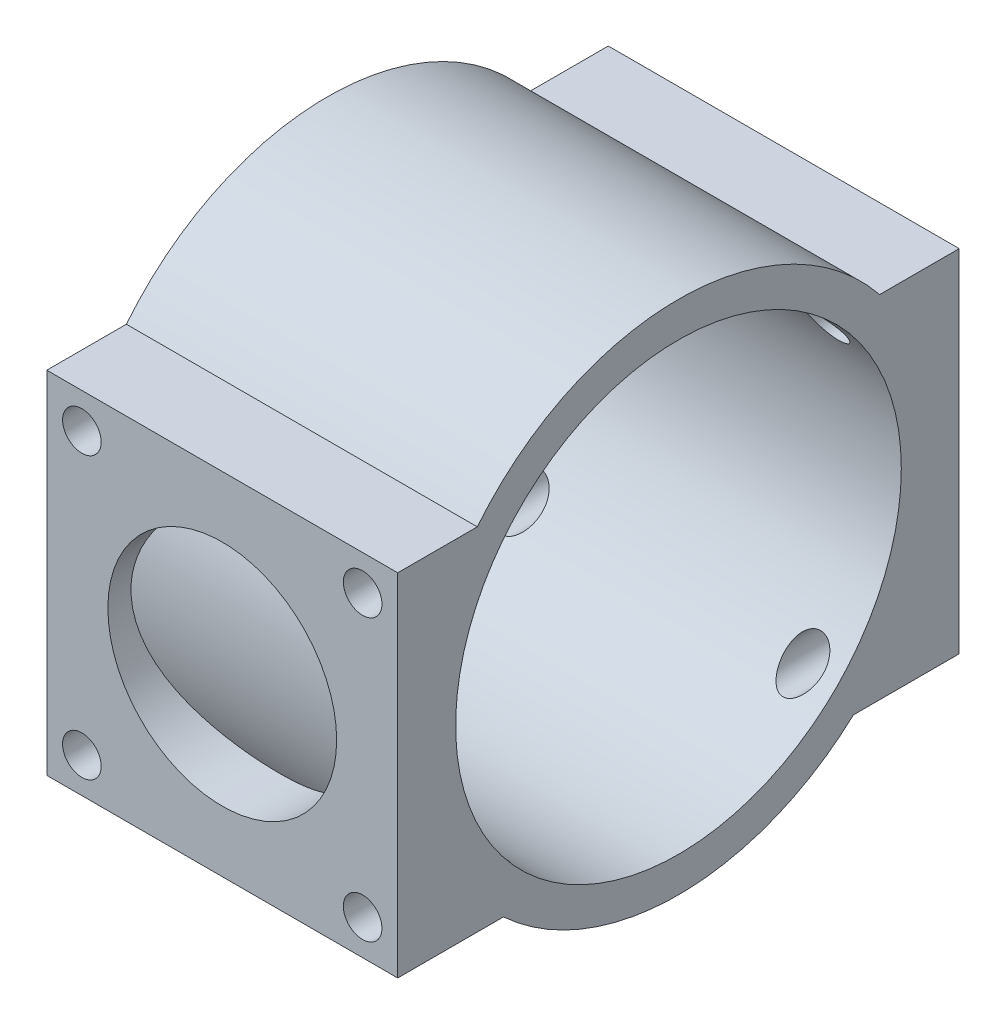
from build123d import *
from build123d.topology import SkipClean

# Parameters (mm, degrees)
SKETCH1_W               = 50
SKETCH1_H               = 50
SKETCH1_R               = 16.3
SKETCH1_R_2             = 2.75
BOSS_EXTRUDE1_DEPTH     = 40
CUT_EXTRUDE1_DEPTH      = 55.350712967
CUT_EXTRUDE1_DEPTH_BACK = 55.350712967
SKETCH2_R               = 31.75
BOSS_EXTRUDE2_DEPTH     = 50
CUT_EXTRUDE2_DEPTH      = 50
CUT_EXTRUDE2_DEPTH_BACK = 60.796007501
SKETCH1_2_R             = 2.75
BOSS_EXTRUDE3_START     = -40
SKETCH1_3_W             = 50
SKETCH1_3_H             = 50
SKETCH1_3_R             = 16.3
SKETCH1_3_R_2           = 2.75
BOSS_EXTRUDE3_DEPTH     = 40
CUT_EXTRUDE3_DEPTH      = 74.827925055
SCALE1_SCALE            = 1.015


with BuildPart() as part:
    # Sketch1 → Boss-Extrude1 (new body)
    with BuildSketch(Plane.XY):
        with Locations((0, -2)):
            Rectangle(SKETCH1_W, SKETCH1_H)
        with Locations((0, -2)):
            Circle(SKETCH1_R, mode=Mode.SUBTRACT)
        with Locations((-20, 18)):
            Circle(SKETCH1_R_2, mode=Mode.SUBTRACT)
        with Locations((20, 18)):
            Circle(SKETCH1_R_2, mode=Mode.SUBTRACT)
        with Locations((20, -22)):
            Circle(SKETCH1_R_2, mode=Mode.SUBTRACT)
        with Locations((-20, -22)):
            Circle(SKETCH1_R_2, mode=Mode.SUBTRACT)
    extrude(amount=BOSS_EXTRUDE1_DEPTH)

    # Sketch2 → Cut-Extrude1 (cut, two sides: drawn at the far end of the back side and taken through both)
    with BuildSketch(Plane(origin=(0, 0, 0), x_dir=(0, 0, -1), z_dir=(1, 0, 0)).offset(-CUT_EXTRUDE1_DEPTH_BACK)):
        Circle(SKETCH2_R)
    extrude(amount=CUT_EXTRUDE1_DEPTH + CUT_EXTRUDE1_DEPTH_BACK, mode=Mode.SUBTRACT)

    # Sketch3 → Boss-Extrude2 (add)
    with BuildSketch(Plane(origin=(25, 0, 0), x_dir=(0, 0, -1), z_dir=(1, 0, 0))):
        with BuildLine():
            ThreePointArc((-25.334346262, 26.622047244), (36.554180512, 3.788718396), (-19.33589834, -31.251968504))
            ThreePointArc((-19.33589834, -31.251968504), (-36.554180512, -3.788718396), (-25.334346262, 26.622047244))
        make_face()
        with BuildLine():
            ThreePointArc((-21.887496431, 23), (-31.580822619, -3.273246506), (-16.705163872, -27))
            ThreePointArc((-16.705163872, -27), (31.580822619, 3.273246506), (-21.887496431, 23))
        make_face(mode=Mode.SUBTRACT)
    extrude(amount=-BOSS_EXTRUDE2_DEPTH)

    # Sketch1<2> → Cut-Extrude2 (cut, two sides: drawn at the far end of the back side and taken through both)
    with BuildSketch(Plane.XY.offset(-CUT_EXTRUDE2_DEPTH_BACK)):
        with Locations((-20, 18)):
            Circle(SKETCH1_2_R)
        with Locations((20, 18)):
            Circle(SKETCH1_2_R)
        with Locations((20, -22)):
            Circle(SKETCH1_2_R)
        with Locations((-20, -22)):
            Circle(SKETCH1_2_R)
    extrude(amount=CUT_EXTRUDE2_DEPTH + CUT_EXTRUDE2_DEPTH_BACK, mode=Mode.SUBTRACT)

    # Sketch1<3> → Boss-Extrude3 (add)
    with SkipClean():  # the faces are left unmerged after this step: merging them gives an invalid solid
        with BuildSketch(Plane.XY.offset(BOSS_EXTRUDE3_START)):
            with Locations((0, -2)):
                Rectangle(SKETCH1_3_W, SKETCH1_3_H)
            with Locations((0, -2)):
                Circle(SKETCH1_3_R, mode=Mode.SUBTRACT)
            with Locations((-20, 18)):
                Circle(SKETCH1_3_R_2, mode=Mode.SUBTRACT)
            with Locations((20, 18)):
                Circle(SKETCH1_3_R_2, mode=Mode.SUBTRACT)
            with Locations((20, -22)):
                Circle(SKETCH1_3_R_2, mode=Mode.SUBTRACT)
            with Locations((-20, -22)):
                Circle(SKETCH1_3_R_2, mode=Mode.SUBTRACT)
        extrude(amount=BOSS_EXTRUDE3_DEPTH)

    # Sketch3<2> → Cut-Extrude3 (cut, through all)
    with SkipClean():  # the faces are left unmerged after this step: merging them gives an invalid solid
        with BuildSketch(Plane(origin=(25, 0, 0), x_dir=(0, 0, -1), z_dir=(1, 0, 0))):
            with BuildLine():
                ThreePointArc((-16.705163872, -27), (31.580822619, 3.273246506), (-21.887496431, 23))
                ThreePointArc((-21.887496431, 23), (-31.580822619, -3.273246506), (-16.705163872, -27))
            make_face()
        extrude(amount=-CUT_EXTRUDE3_DEPTH, mode=Mode.SUBTRACT)


with BuildPart() as part_1:
    # Scale1: scaled about (-1.4047e-05, -1.30494697, -0.000162806)
    add(part.part.scale(SCALE1_SCALE).moved(Location((2.11e-07, 0.019574205, 2.442e-06))))


solid = part_1.part
